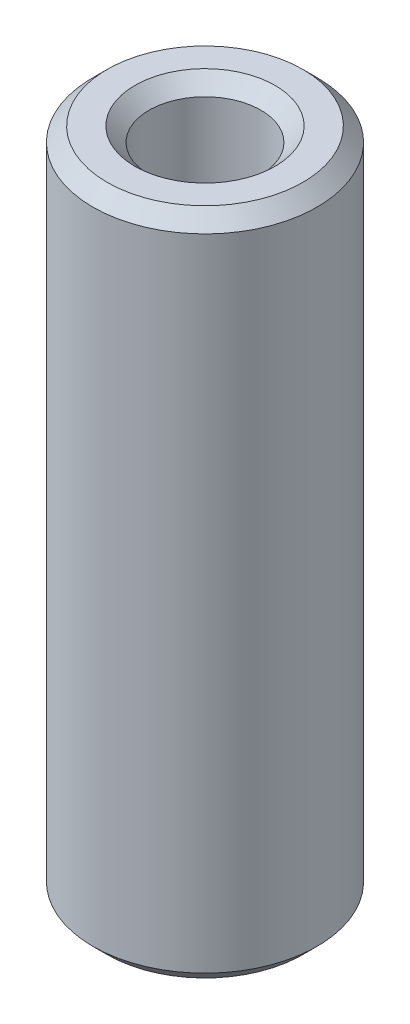
from build123d import *

# Parameters (mm, degrees)
SKETCH1_R           = 7.5
BOSS_EXTRUDE1_DEPTH = 44.727620055
SKETCH2_R           = 3.734883404
CUT_EXTRUDE1_DEPTH  = 46.968032324
CHAMFER1_SIZE       = 0.955096713


with BuildPart() as part:
    # Sketch1 → Boss-Extrude1 (new body)
    with BuildSketch(Plane(origin=(0, 0, 0), x_dir=(1, 0, 0), z_dir=(0, 1, 0))):
        Circle(SKETCH1_R)
    extrude(amount=BOSS_EXTRUDE1_DEPTH)

    # Sketch2 → Cut-Extrude1 (cut, through all)
    with BuildSketch(Plane(origin=(0, 0, 0), x_dir=(1, 0, 0), z_dir=(0, 1, 0))):
        Circle(SKETCH2_R)
    extrude(amount=CUT_EXTRUDE1_DEPTH, mode=Mode.SUBTRACT)

    # Chamfer1
    chamfer1_edges = [part.edges().sort_by_distance(p)[0] for p in [
        (-3.734883404, 44.727620055, 0),
        (-3.734883404, 0, 0),
        (-7.5, 0, 0),
        (-7.5, 44.727620055, 0),
    ]]
    chamfer(chamfer1_edges, length=CHAMFER1_SIZE)


solid = part.part
